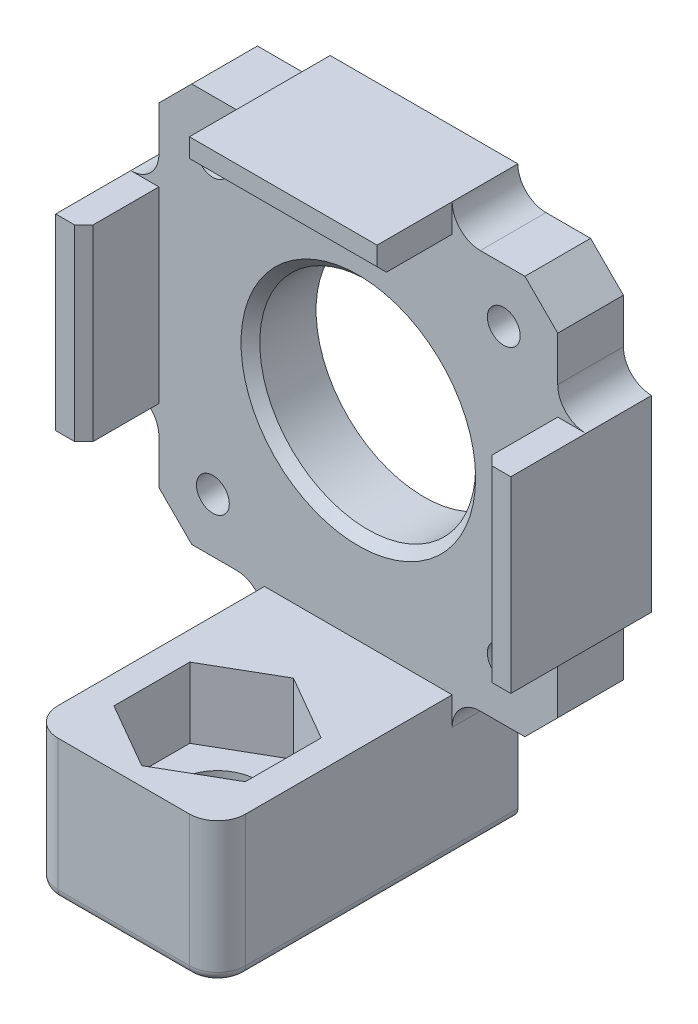
from build123d import *

# Parameters (mm, degrees)
ESQUISSE1_R             = 11.5
ESQUISSE1_R_2           = 1.75
BOSS_EXTRU_1_DEPTH      = 7
ESQUISSE2_W             = 20
ESQUISSE2_H             = 3
ESQUISSE2_W_2           = 3
ESQUISSE2_H_2           = 20
BOSS_EXTRU_2_DEPTH      = 15
ESQUISSE3_W             = 20
ESQUISSE3_H             = 15
BOSS_EXTRU_3_DEPTH      = 32
CONG_1_R                = 3
CONG_2_R                = 3
CHANFREIN1_SIZE         = 1
ESQUISSE4_R             = 4.25
ENL_V_MAT_EXTRU_1_DEPTH = 15
CONG_3_R                = 1
ENL_V_MAT_EXTRU_2_DEPTH = 7.5


with BuildPart() as part:
    # Esquisse1 → Boss.-Extru.1 (new body)
    with BuildSketch(Plane.XY):
        Polygon((-17.749999999, 21.249999999), (-21.249999999, 17.749999999), (-21.249999999, -17.749999999), (-17.749999999, -21.250000001), (17.749999999, -21.250000001), (21.249999999, -17.749999999), (21.249999999, 17.749999999), (17.749999999, 21.249999999), align=None)
        Circle(ESQUISSE1_R, mode=Mode.SUBTRACT)
        with Locations((-15.5, 15.5)):
            Circle(ESQUISSE1_R_2, mode=Mode.SUBTRACT)
        with Locations((15.5, 15.5)):
            Circle(ESQUISSE1_R_2, mode=Mode.SUBTRACT)
        with Locations((15.5, -15.5)):
            Circle(ESQUISSE1_R_2, mode=Mode.SUBTRACT)
        with Locations((-15.5, -15.5)):
            Circle(ESQUISSE1_R_2, mode=Mode.SUBTRACT)
    extrude(amount=BOSS_EXTRU_1_DEPTH)

    # Esquisse2 → Boss.-Extru.2 (add)
    with BuildSketch(Plane(origin=(0, 0, 0), x_dir=(-1, 0, 0), z_dir=(0, 0, -1))):
        with Locations((0, 22.749999999)):
            Rectangle(ESQUISSE2_W, ESQUISSE2_H)
        with Locations((22.749999999, 0)):
            Rectangle(ESQUISSE2_W_2, ESQUISSE2_H_2)
        with Locations((-22.749999999, 0)):
            Rectangle(ESQUISSE2_W_2, ESQUISSE2_H_2)
    extrude(amount=-BOSS_EXTRU_2_DEPTH)

    # Esquisse3 → Boss.-Extru.3 (add)
    with BuildSketch(Plane(origin=(0, 0, 0), x_dir=(-1, 0, 0), z_dir=(0, 0, -1))):
        with Locations((0, -28.750000001)):
            Rectangle(ESQUISSE3_W, ESQUISSE3_H)
    extrude(amount=-BOSS_EXTRU_3_DEPTH)

    # Congé1
    cong_1_edges = [part.edges().sort_by_distance(p)[0] for p in [
        (-21.249999999, -10, 3.5),
        (-21.249999999, 10, 3.5),
        (-10, 21.249999999, 3.5),
        (10, 21.249999999, 3.5),
        (21.249999999, 10, 3.5),
        (21.249999999, -10, 3.5),
        (10, -21.250000001, 3.5),
        (-10, -21.250000001, 3.5),
    ]]
    fillet(cong_1_edges, radius=CONG_1_R - 0.0001)  # a hair under: the kernel refuses the full size

    # Congé2
    cong_2_edges = [part.edges().sort_by_distance(p)[0] for p in [
        (10, -28.750000001, 32),
        (-10, -28.750000001, 32),
    ]]
    fillet(cong_2_edges, radius=CONG_2_R)

    # Chanfrein1
    chanfrein1_edges = [part.edges().sort_by_distance(p)[0] for p in [
        (-11.5, 0, 7),
        (0, 21.249999999, 15),
        (-21.249999999, 0, 15),
        (21.249999999, 0, 15),
    ]]
    chamfer(chanfrein1_edges, length=CHANFREIN1_SIZE)

    # Esquisse4 → Enlèv. mat.-Extru.1 (cut)
    with BuildSketch(Plane(origin=(0, -36.250000001, 0), x_dir=(-1, 0, 0), z_dir=(0, -1, 0))):
        with Locations(Location((0, -22, 0), (0, 0, 90))):
            Circle(ESQUISSE4_R)
    extrude(amount=-ENL_V_MAT_EXTRU_1_DEPTH, mode=Mode.SUBTRACT)

    # Congé3
    cong_3_edges = [part.edges().sort_by_distance(p)[0] for p in [
        (10, -36.250000001, 14.5),
        (0, -36.250000001, 32),
        (-10, -36.250000001, 14.5),
        (-9.121320344, -36.250000001, 31.121320344),
        (9.121320344, -36.250000001, 31.121320344),
    ]]
    fillet(cong_3_edges, radius=CONG_3_R)

    # Esquisse5 → Enlèv. mat.-Extru.2 (cut)
    with BuildSketch(Plane(origin=(0, -21.250000001, 0), x_dir=(1, 0, 0), z_dir=(0, 1, 0))):
        Polygon((0, -30.082903769), (7, -26.041451884), (7, -17.958548116), (0, -13.917096231), (-7, -17.958548116), (-7, -26.041451884), align=None)
    extrude(amount=-ENL_V_MAT_EXTRU_2_DEPTH, mode=Mode.SUBTRACT)


solid = part.part
